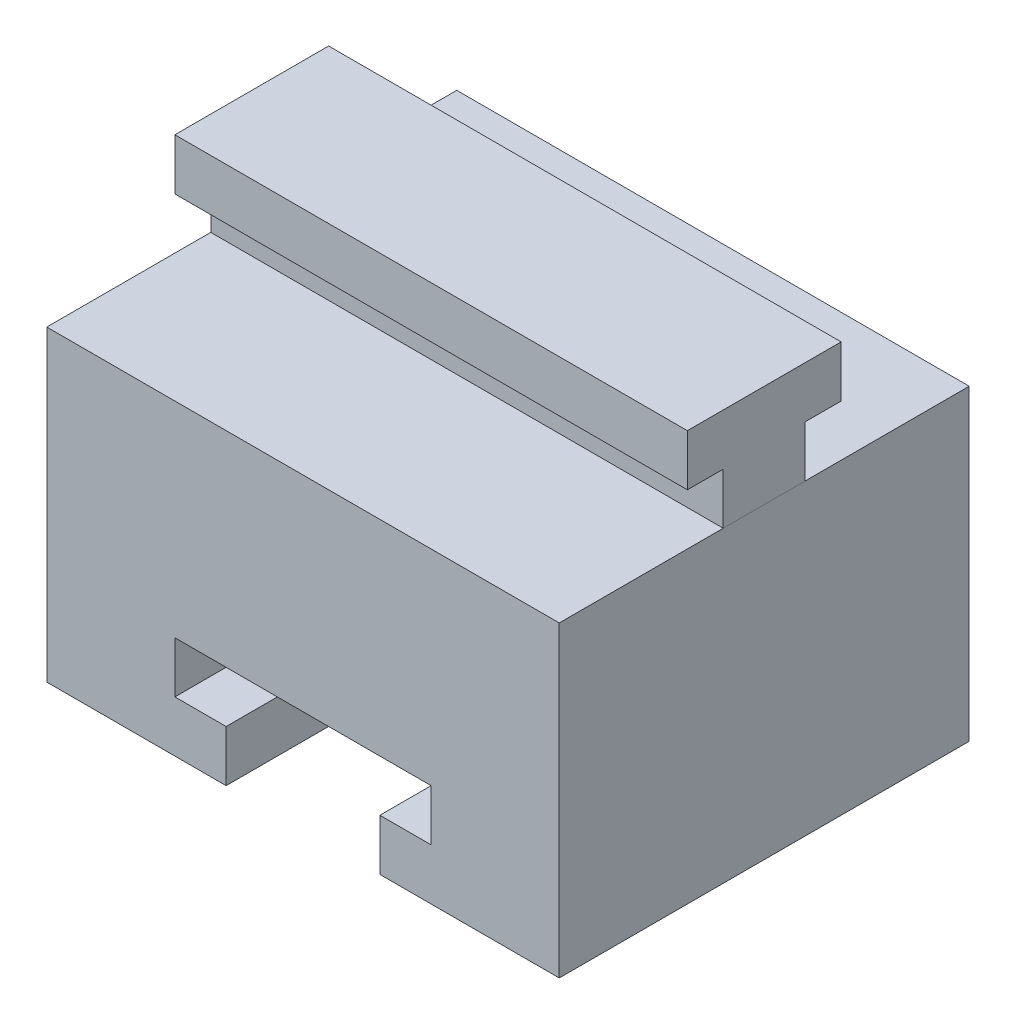
from build123d import *

# Parameters (mm, degrees)
SKETCH1_W                = 50
SKETCH1_H                = 30
BOSS_EXTRUDE1_DEPTH      = 40
CUT_EXTRUDE12_START      = -40
CUT_EXTRUDE12_DEPTH      = 40
BOSS_EXTRUDE2_DEPTH      = 12.285714
BOSS_EXTRUDE2_DEPTH_BACK = 37.714286


# Read off the part's stored shape, not the designer's step: Cut-Extrude12
with BuildPart() as part:
    # Sketch1 → Boss-Extrude1 (new body)
    with BuildSketch(Plane.XY):
        with Locations((-12.714285714, -6.857142857)):
            Rectangle(SKETCH1_W, SKETCH1_H)
    extrude(amount=BOSS_EXTRUDE1_DEPTH)

    # Cut-Extrude12 outline → Cut-Extrude12 (cut)
    with BuildSketch(Plane.XY.offset(40).offset(CUT_EXTRUDE12_START)):
        Polygon((-25.214285714, -16.857142857), (-20.214285714, -16.857142857), (-20.214285714, -21.857142857), (-5.214285714, -21.857142857), (-5.214285714, -16.857142857), (-0.214285714, -16.857142857), (-0.214285714, -11.857142857), (-25.214285714, -11.857142857), align=None)
    extrude(amount=CUT_EXTRUDE12_DEPTH, mode=Mode.SUBTRACT)


with BuildPart() as body_2:
    # Sketch3 → Boss-Extrude2 (new, two sides: drawn at the far end of the back side and taken through both)
    with BuildSketch(Plane(origin=(0, 0, 0), x_dir=(0, 0, -1), z_dir=(1, 0, 0)).offset(-BOSS_EXTRUDE2_DEPTH_BACK)):
        Polygon((-24, 8.142857143), (-16, 8.142857143), (-16, 13.139548849), (-12.5, 13.139548849), (-12.5, 18.139548849), (-27.5, 18.139548849), (-27.5, 13.139548849), (-24, 13.139548849), align=None)
    extrude(amount=BOSS_EXTRUDE2_DEPTH + BOSS_EXTRUDE2_DEPTH_BACK)


solid = Compound([part.part, body_2.part])
